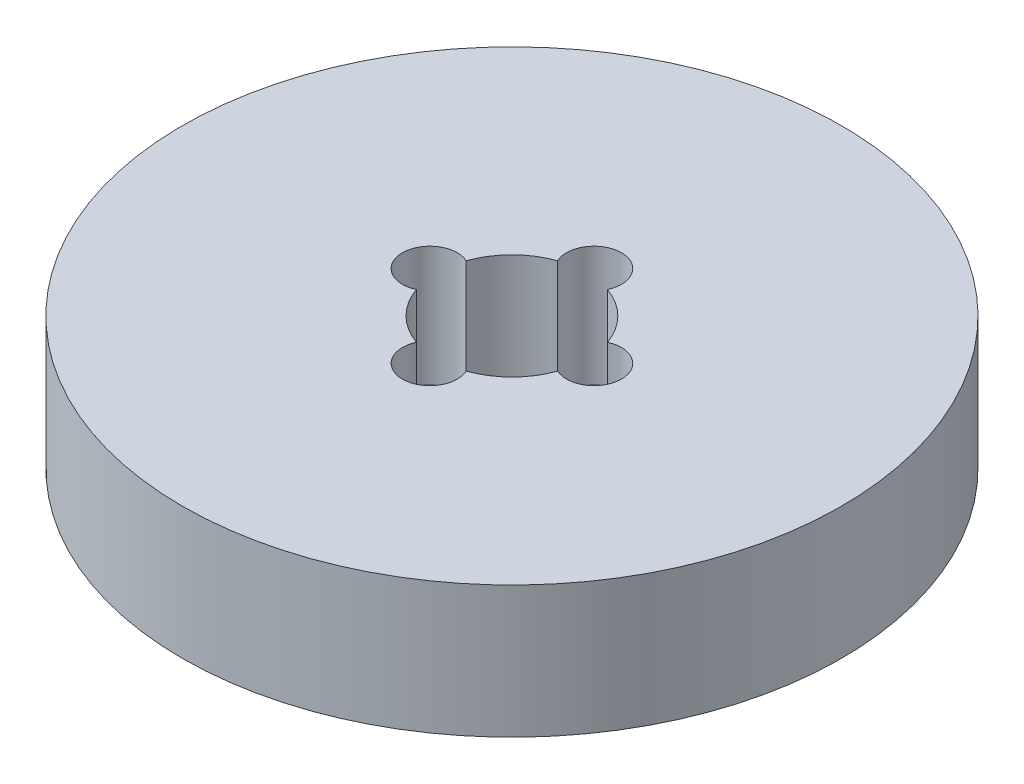
from build123d import *

# Parameters (mm, degrees)
SKETCH1_R           = 55
BOSS_EXTRUDE1_DEPTH = 22
SKETCH2_R           = 12.5
CUT_EXTRUDE1_DEPTH  = 81.833161512
SKETCH3_R           = 4.575686768
CUT_EXTRUDE2_DEPTH  = 20.066068192
CIRPATTERN1_COUNT   = 4


with BuildPart() as part:
    # Sketch1 → Boss-Extrude1 (new body)
    with BuildSketch(Plane(origin=(0, 0, 0), x_dir=(1, 0, 0), z_dir=(0, 1, 0))):
        Circle(SKETCH1_R)
    extrude(amount=BOSS_EXTRUDE1_DEPTH)

    # Sketch2 → Cut-Extrude1 (cut, through all)
    with BuildSketch(Plane(origin=(0, 0, 0), x_dir=(1, 0, 0), z_dir=(0, 1, 0))):
        Circle(SKETCH2_R)
    extrude(amount=CUT_EXTRUDE1_DEPTH, mode=Mode.SUBTRACT)

    # Sketch3 → Cut-Extrude2 (cut)
    with BuildSketch(Plane(origin=(0, 22, 0), x_dir=(1, 0, 0), z_dir=(0, 1, 0))):
        with Locations((-13.697071133, 0)):
            Circle(SKETCH3_R)
    cut_extrude2 = extrude(amount=-CUT_EXTRUDE2_DEPTH, mode=Mode.SUBTRACT)

    # CirPattern1: Cut-Extrude2 ×4 about axis
    cirpattern1_axis = Axis((0, 0, 0), (0, 1, 0))
    for i in range(1, CIRPATTERN1_COUNT):
        add(cut_extrude2.rotate(cirpattern1_axis, i * 360 / CIRPATTERN1_COUNT), mode=Mode.SUBTRACT)


solid = part.part
